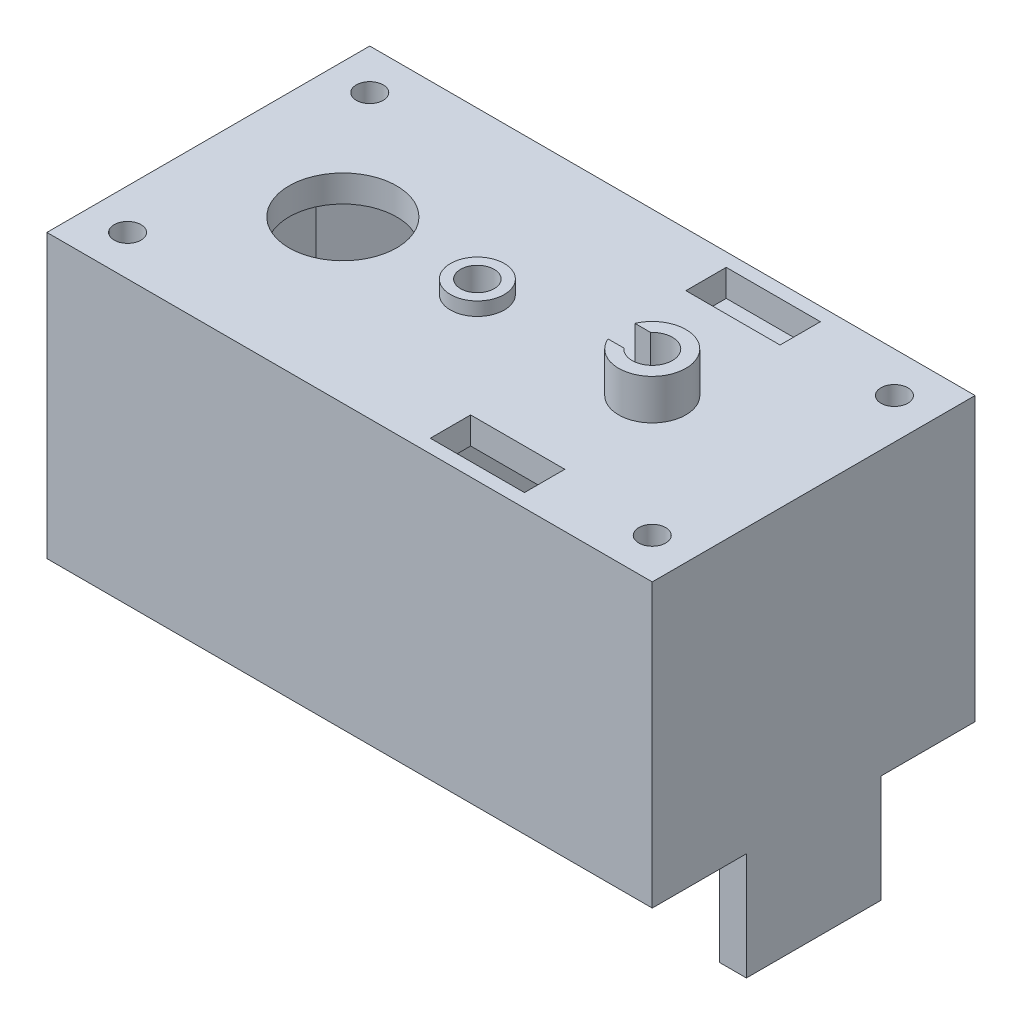
from build123d import *
from build123d.topology import SkipClean

# Parameters (mm, degrees)
SKETCH1_W           = 22.5
SKETCH1_H           = 12
SKETCH1_W_2         = 11.5
SKETCH1_H_2         = 10
SKETCH1_W_3         = 8
BOSS_EXTRUDE1_DEPTH = 10.5
SKETCH2_W           = 22.5
SKETCH2_H           = 12
SKETCH2_R           = 2
SKETCH2_R_2         = 0.75
SKETCH2_W_2         = 3.5
SKETCH2_H_2         = 1.5
BOSS_EXTRUDE2_DEPTH = 1
SKETCH3_W           = 3.5
SKETCH3_H           = 1.5
CUT_EXTRUDE1_DEPTH  = 1
SKETCH4_W           = 10
SKETCH4_H           = 2.5
CUT_EXTRUDE2_DEPTH  = 1
CHAMFER1_SIZE       = 2
SKETCH5_R           = 0.5
CUT_EXTRUDE3_DEPTH  = 17.517036659
SKETCH6_W           = 1
SKETCH6_H           = 5
BOSS_EXTRUDE3_DEPTH = 4
BOSS_EXTRUDE4_DEPTH = 1.75
SKETCH8_R           = 0.625
CUT_EXTRUDE4_DEPTH  = 1.75
SKETCH9_R           = 1
BOSS_EXTRUDE5_DEPTH = 0.25
BOSS_EXTRUDE6_START = 0.5
SKETCH10_R          = 1
SKETCH10_R_2        = 0.625
BOSS_EXTRUDE6_DEPTH = 0.5
BOSS_EXTRUDE7_START = 1.5
SKETCH11_R          = 1.25
SKETCH11_R_2        = 0.75
BOSS_EXTRUDE7_DEPTH = 1.5
CUT_EXTRUDE5_DEPTH  = 1.5


with BuildPart() as part:
    # Sketch1 → Boss-Extrude1 (new body)
    with BuildSketch(Plane(origin=(0, 0, 0), x_dir=(1, 0, 0), z_dir=(0, 1, 0))):
        Rectangle(SKETCH1_W, SKETCH1_H)
        with Locations((4.5, 0)):
            Rectangle(SKETCH1_W_2, SKETCH1_H_2, mode=Mode.SUBTRACT)
        with Locations((-6.25, 0)):
            Rectangle(SKETCH1_W_3, SKETCH1_H_2, mode=Mode.SUBTRACT)
    extrude(amount=BOSS_EXTRUDE1_DEPTH)

    # Sketch2 → Boss-Extrude2 (add)
    with BuildSketch(Plane(origin=(0, 10.5, 0), x_dir=(1, 0, 0), z_dir=(0, 1, 0))):
        Rectangle(SKETCH2_W, SKETCH2_H)
        with Locations((-6.25, 0)):
            Circle(SKETCH2_R, mode=Mode.SUBTRACT)
        with Locations((5.25, 0)):
            Circle(SKETCH2_R_2, mode=Mode.SUBTRACT)
        with Locations((4.25, 4.75)):
            Rectangle(SKETCH2_W_2, SKETCH2_H_2, mode=Mode.SUBTRACT)
        with Locations((4.25, -4.75)):
            Rectangle(SKETCH2_W_2, SKETCH2_H_2, mode=Mode.SUBTRACT)
    extrude(amount=-BOSS_EXTRUDE2_DEPTH)

    # Sketch3 → Cut-Extrude1 (cut)
    with BuildSketch(Plane(origin=(0, 10.5, 0), x_dir=(1, 0, 0), z_dir=(0, 1, 0))):
        with Locations((4.25, 4.75)):
            Rectangle(SKETCH3_W, SKETCH3_H)
        with Locations((4.25, -4.75)):
            Rectangle(SKETCH3_W, SKETCH3_H)
    extrude(amount=-CUT_EXTRUDE1_DEPTH, mode=Mode.SUBTRACT)

    # Sketch4 → Cut-Extrude2 (cut)
    with BuildSketch(Plane.ZY.offset(2.25)):
        with Locations((0, 1.25)):
            Rectangle(SKETCH4_W, SKETCH4_H)
    extrude(amount=-CUT_EXTRUDE2_DEPTH, mode=Mode.SUBTRACT)

    # Chamfer1
    chamfer1_edges = [part.edges().sort_by_distance(p)[0] for p in [
        (10.25, 4.75, -5),
        (10.25, 4.75, 5),
        (-10.25, 4.75, 5),
        (-10.25, 4.75, -5),
    ]]
    chamfer(chamfer1_edges, length=CHAMFER1_SIZE)

    # Sketch5 → Cut-Extrude3 (cut, through all)
    with BuildSketch(Plane.XZ):
        with Locations((-9.75, 4.5)):
            Circle(SKETCH5_R)
        with Locations((9.75, 4.5)):
            Circle(SKETCH5_R)
        with Locations((9.75, -4.5)):
            Circle(SKETCH5_R)
        with Locations((-9.75, -4.5)):
            Circle(SKETCH5_R)
    extrude(amount=-CUT_EXTRUDE3_DEPTH, mode=Mode.SUBTRACT)

    # Sketch6 → Boss-Extrude3 (add)
    with BuildSketch(Plane.XZ):
        with Locations((10.75, 0)):
            Rectangle(SKETCH6_W, SKETCH6_H)
    extrude(amount=BOSS_EXTRUDE3_DEPTH)

    # Sketch7 → Boss-Extrude4 (add)
    with BuildSketch(Plane(origin=(0, 10.5, 0), x_dir=(1, 0, 0), z_dir=(0, 1, 0))):
        with BuildLine():
            Line((-1.25, -0.625), (-1.25, -1))
            ThreePointArc((-1.25, -1), (-0.542893219, -0.707106781), (-0.25, 0))
            ThreePointArc((-0.25, 0), (-0.542893219, 0.707106781), (-1.25, 1))
            Line((-1.25, 1), (-1.25, 0.625))
            ThreePointArc((-1.25, 0.625), (-0.808058262, 0.441941738), (-0.625, 0))
            ThreePointArc((-0.625, 0), (-0.808058262, -0.441941738), (-1.25, -0.625))
        make_face()
    extrude(amount=-BOSS_EXTRUDE4_DEPTH)

    # Sketch8 → Cut-Extrude4 (cut)
    with SkipClean():  # the faces are left unmerged after this step: merging them gives an invalid solid
        with BuildSketch(Plane(origin=(0, 10.5, 0), x_dir=(1, 0, 0), z_dir=(0, 1, 0))):
            with Locations((-1.25, 0)):
                Circle(SKETCH8_R)
        extrude(amount=-CUT_EXTRUDE4_DEPTH, mode=Mode.SUBTRACT)

    # Sketch9 → Boss-Extrude5 (add)
    with SkipClean():  # the faces are left unmerged after this step: merging them gives an invalid solid
        with BuildSketch(Plane.XZ.offset(-8.75)):
            with Locations((-1.25, 0)):
                Circle(SKETCH9_R)
        extrude(amount=BOSS_EXTRUDE5_DEPTH)

    # Sketch10 → Boss-Extrude6 (add)
    with BuildSketch(Plane(origin=(0, 10.5, 0), x_dir=(1, 0, 0), z_dir=(0, 1, 0)).offset(BOSS_EXTRUDE6_START)):
        with Locations((-1.25, 0)):
            Circle(SKETCH10_R)
        with Locations((-1.25, 0)):
            Circle(SKETCH10_R_2, mode=Mode.SUBTRACT)
    extrude(amount=-BOSS_EXTRUDE6_DEPTH)

    # Sketch11 → Boss-Extrude7 (add)
    with BuildSketch(Plane(origin=(0, 10.5, 0), x_dir=(1, 0, 0), z_dir=(0, 1, 0)).offset(BOSS_EXTRUDE7_START)):
        with Locations((5.25, 0)):
            Circle(SKETCH11_R)
        with Locations((5.25, 0)):
            Circle(SKETCH11_R_2, mode=Mode.SUBTRACT)
    extrude(amount=-BOSS_EXTRUDE7_DEPTH)

    # Sketch12 → Cut-Extrude5 (cut)
    with BuildSketch(Plane(origin=(0, 12, 0), x_dir=(1, 0, 0), z_dir=(0, 1, 0))):
        with BuildLine():
            Line((4.104356076, 0.5), (4.690983006, 0.5))
            ThreePointArc((4.690983006, 0.5), (4.5, 0), (4.690983006, -0.5))
            Line((4.690983006, -0.5), (4.104356076, -0.5))
            ThreePointArc((4.104356076, -0.5), (4, 0), (4.104356076, 0.5))
        make_face()
    extrude(amount=-CUT_EXTRUDE5_DEPTH, mode=Mode.SUBTRACT)


solid = part.part
